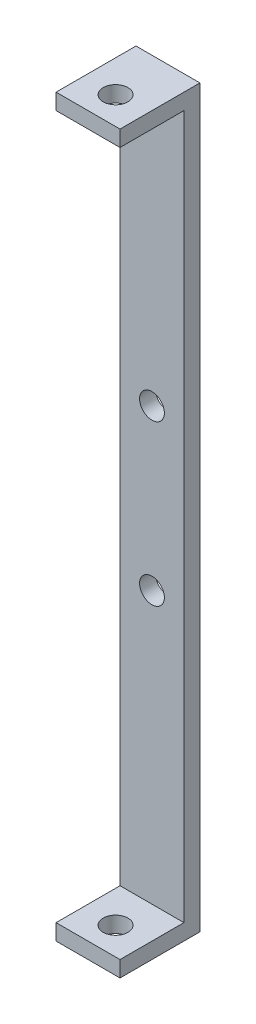
from build123d import *

# Parameters (mm, degrees)
EXTRUDE_2_DEPTH     = 8
SKETCH_3D_1_R       = 1.55
CUT_EXTRUDE_1_DEPTH = 93.320072231
SKETCH_3D_2_R       = 1.55
CUT_EXTRUDE_2_DEPTH = 58.026309718


with BuildPart() as part:
    # 草图1 → 凸台-拉伸2 (new body)
    with BuildSketch(Plane(origin=(0, 0, 0), x_dir=(0, 0, -1), z_dir=(1, 0, 0))):
        Polygon((0, 0), (10, 0), (10, 92), (0, 92), (0, 90), (8, 90), (8, 2), (0, 2), align=None)
    extrude(amount=EXTRUDE_2_DEPTH)

    # Sketch 3D_1 → 切除-拉伸1 (cut, through all)
    with BuildSketch(Plane(origin=(4, 0, -3.442886554), x_dir=(0, 0, -1), z_dir=(0, -1, 0))):
        Circle(SKETCH_3D_1_R)
    extrude(amount=-CUT_EXTRUDE_1_DEPTH, mode=Mode.SUBTRACT)

    # Sketch 3D_2 → 切除-拉伸2 (cut, through all)
    with BuildSketch(Plane(origin=(4, 36, -10), x_dir=(0, -1, 0), z_dir=(0, 0, -1))):
        Circle(SKETCH_3D_2_R)
        with Locations((-20, 0)):
            Circle(SKETCH_3D_2_R)
    extrude(amount=-CUT_EXTRUDE_2_DEPTH, mode=Mode.SUBTRACT)


solid = part.part
